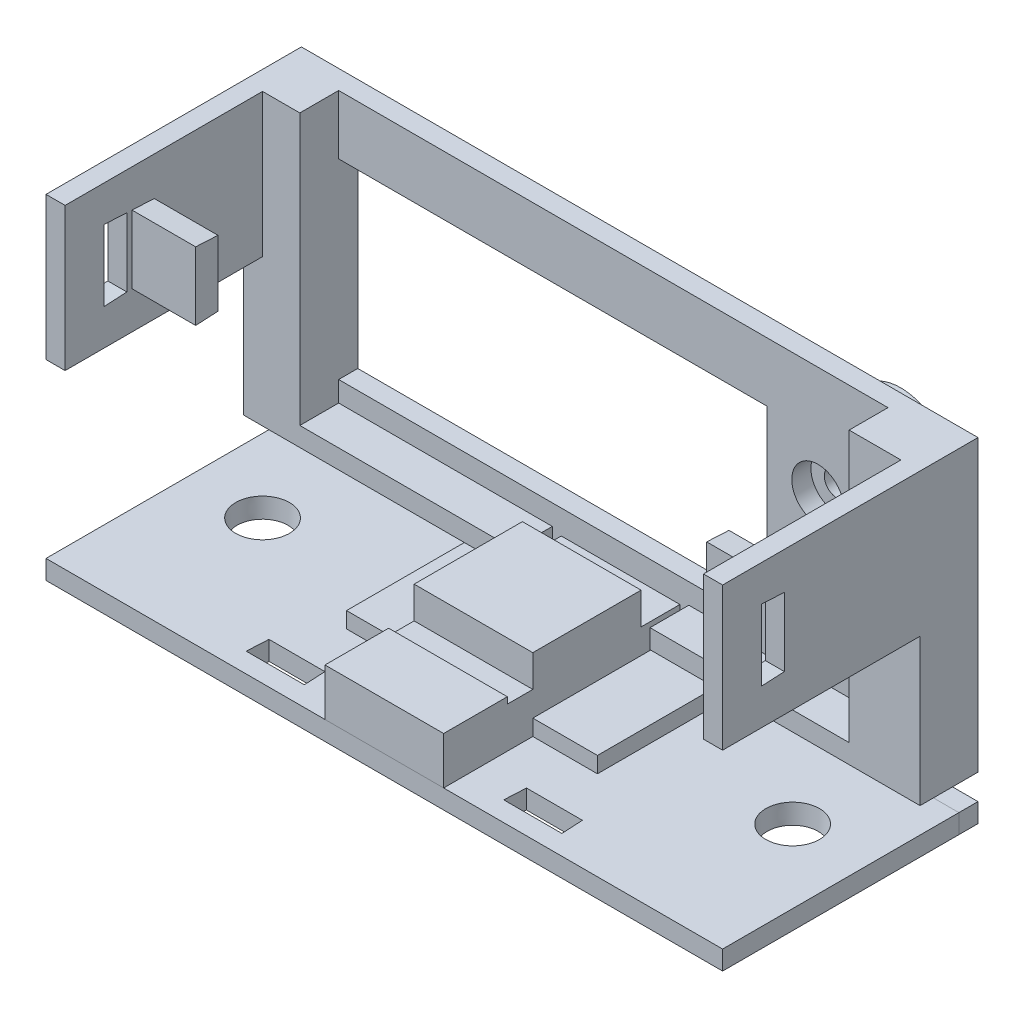
from build123d import *

# Parameters (mm, degrees)
SKETCH1_W                              = 53.116817528
SKETCH1_H                              = 26.25
FRONT_SIDE_MAIN_DEPTH                  = 1.5
RESET_HOLE_DEPTH                       = 3.75
SKETCH15_W                             = 3.966010581
SKETCH15_H                             = 2.112155191
SKETCH15_W_2                           = 3.557190409
SKETCH15_H_2                           = 2.236587576
SKETCH15_W_3                           = 3.981127105
SKETCH15_H_3                           = 2.476855865
COMPONENT_HOLES_DEPTH                  = 3.75
SKETCH16_W                             = 10.85
SKETCH16_H                             = 14.75
MICROPHONE_HOLE_DEPTH                  = 1.5
SKETCH24_W                             = 1.5
SKETCH24_H                             = 11.233042059
RIGHT_SIDE_TOP_DEPTH                   = 18.55
SNAP_GROOVE_RIGHT_DEPTH                = 1.5
SKETCH26_W                             = 1.5
SKETCH26_H                             = 11.233042059
LEFT_SIDE_TOP_DEPTH                    = 18.55
SNAP_START                             = 51.616817528
SNAP_GROOVE_LEFT_DEPTH                 = 1.5
SKETCH20_W                             = 53.116817528
SKETCH20_H                             = 1.5
BOTTOM_BASE_DEPTH                      = 18.55
SERVO_START                            = -1.5
SKETCH18_W                             = 9.316817528
SKETCH18_H                             = 3.2
SERVO_SEPERATOR_BOTTOM_DEPTH           = 20.05
SKETCH34_W                             = 2.537171882
SKETCH34_H                             = 15
PROGRAMMING_HOLE_DEPTH                 = 3.75
SKETCH38_W                             = 9.316817528
SKETCH38_H                             = 5
BACK_BATTERY_HOLDER_BOTTOM_DEPTH       = 0.504457941
SKETCH40_R                             = 2
SERVO_ARM_HOLES_BOTTOM_DEPTH           = 1.5
SERVO_ARM_HOLES_BOTTOM_DRAFT           = 4
SERVO_ARM_HOLES_BOTTOM_PROFILE_2_DEPTH = 1.5
SERVO_ARM_HOLES_BOTTOM_PROFILE_2_DRAFT = 4
SKETCH47_W                             = 11
SKETCH47_H                             = 2
SOLAR_ARM_HOLES_FRONT_DEPTH            = 1.5
SKETCH48_W                             = 9.316817528
SKETCH48_H                             = 8.5
SERVO_TALLER_SEPERATOR_BOTTOM_DEPTH    = 2.5
SKETCH51_W                             = 5.074553148
SKETCH51_H                             = 11.55
SKETCH51_W_2                           = 5.306259021
SERVO_LIFTERS_BOTTOM_DEPTH             = 1.25
SKETCH52_W                             = 21.2
SKETCH52_H                             = 1.5
SERVO_UNDER_SUPPORT_DEPTH              = 3.05
SKETCH49_W                             = 1.573389805
SKETCH49_H                             = 10.535992885
SERVO_2_CASE_SPACER_FRONT_DEPTH        = 3.05
SERVO_TOP_SUPPORT_RIGHT_DEPTH          = 5
SERVO_TOP_SUPPORT_LEFT_DEPTH           = 5
SNAP_GROOVE_BOTTOM_RIGHT_DEPTH         = 1.5
SNAP_GROOVE_BOTTOM_LEFT_DEPTH          = 1.5
SKETCH56_W                             = 32.587188542
SKETCH56_H                             = 15
CUT_EXTRUDE1_DEPTH                     = 1.5
SKETCH57_W                             = 8.5
SKETCH57_H                             = 1.5
BOSS_EXTRUDE1_DEPTH                    = 14.75
SKETCH58_R                             = 2.05
CUT_EXTRUDE2_DEPTH                     = 10
SKETCH59_W                             = 1.5
SKETCH59_H                             = 15
BOSS_EXTRUDE2_DEPTH                    = 1.5
SKETCH60_W                             = 2.925575138
SKETCH60_H                             = 19.525
BOSS_EXTRUDE3_DEPTH                    = 3.05
SKETCH62_W                             = 3.05
SKETCH62_H                             = 10.535992885
BOSS_EXTRUDE4_DEPTH                    = 3.993492161
SKETCH63_W                             = 4.066881966
SKETCH63_H                             = 3.05
BOSS_EXTRUDE5_DEPTH                    = 8.989007115
SKETCH64_W                             = 3.05
SKETCH64_H                             = 8.291957941
BOSS_EXTRUDE6_DEPTH                    = 1.5
BOSS_EXTRUDE7_REACH                    = 62.039
SKETCH65_W                             = 4.425575138
SKETCH65_H                             = 3.05
BOSS_EXTRUDE8_REACH                    = 62.039
SKETCH66_W                             = 5.566881966
SKETCH66_H                             = 3.05
SKETCH67_R                             = 4
SKETCH67_R_2                           = 1
BOSS_EXTRUDE9_DEPTH                    = 5


# Read off the part's stored shape, not the designer's step: Snap Groove - Right, Snap Groove - Left, Snap Groove - Bottom Right, Snap Groove - Bottom Left
with BuildPart() as part:
    # Sketch1 → Front Side - Main (new body)
    with BuildSketch(Plane.XY):
        with Locations((26.558408764, 13.125)):
            Rectangle(SKETCH1_W, SKETCH1_H)
    extrude(amount=FRONT_SIDE_MAIN_DEPTH)

    # Reset Hole Sketch → Reset Hole (cut)
    with BuildSketch(Plane(origin=(0, 0, 3.75), x_dir=(-1, 0, 0), z_dir=(0, 0, -1))):
        Polygon((-31.190735744, 17.626168756), (-34.141748042, 17.658585925), (-36.251351249, 15.594827519), (-36.283768419, 12.643815222), (-34.220010013, 10.534212015), (-31.268997715, 10.501794845), (-29.159394508, 12.565553251), (-29.126977338, 15.516565548), align=None)
    extrude(amount=RESET_HOLE_DEPTH, mode=Mode.SUBTRACT)

    # Sketch15 → Component Holes (cut)
    with BuildSketch(Plane(origin=(0, 0, 3.75), x_dir=(-1, 0, 0), z_dir=(0, 0, -1))):
        Polygon((-21.737702993, 20.027277789), (-15.857179586, 14.146754382), (-21.737702993, 8.266230975), (-27.6182264, 14.146754382), align=None)
        with Locations((-11.649935563, 9.695513201)):
            Rectangle(SKETCH15_W, SKETCH15_H)
        with Locations((-11.599935563, 14.270513201)):
            Rectangle(SKETCH15_W_2, SKETCH15_H_2)
        with Locations((-9.949935563, 18.095513201)):
            Rectangle(SKETCH15_W_3, SKETCH15_H_3)
    extrude(amount=COMPONENT_HOLES_DEPTH, mode=Mode.SUBTRACT)

    # Sketch16 → Microphone Hole (cut)
    with BuildSketch(Plane(origin=(0, 0, 0), x_dir=(-1, 0, 0), z_dir=(0, 0, -1))):
        with Locations((-41.124935562, 14.1)):
            Rectangle(SKETCH16_W, SKETCH16_H)
    extrude(amount=-MICROPHONE_HOLE_DEPTH, mode=Mode.SUBTRACT)

    # Sketch24 → Right Side - Top (add)
    with BuildSketch(Plane.XY.offset(1.5)):
        with Locations((0.75, 20.633478971)):
            Rectangle(SKETCH24_W, SKETCH24_H)
    extrude(amount=RIGHT_SIDE_TOP_DEPTH)

    # Snap Groove - Right outline → Snap Groove - Right (cut)
    with BuildSketch(Plane.YZ):
        Polygon((17.938719748, 15.2), (23.328238192, 15.2), (23.422572195, 17), (17.844385746, 17), align=None)
    extrude(amount=SNAP_GROOVE_RIGHT_DEPTH, mode=Mode.SUBTRACT)

    # Sketch26 → Left Side - Top (add)
    with BuildSketch(Plane.XY.offset(1.5)):
        with Locations((52.366817528, 20.633478971)):
            Rectangle(SKETCH26_W, SKETCH26_H)
    extrude(amount=LEFT_SIDE_TOP_DEPTH)

    # Snap Groove - Left outline → Snap Groove - Left (cut)
    with BuildSketch(Plane.YZ.offset(SNAP_START)):
        Polygon((17.938719748, 15.2), (23.328238192, 15.2), (23.422572195, 17), (17.844385746, 17), align=None)
    extrude(amount=SNAP_GROOVE_LEFT_DEPTH, mode=Mode.SUBTRACT)

    # Sketch18 → Servo Seperator - Bottom (add)
    with BuildSketch(Plane.XY.offset(1.5).offset(SERVO_START)):
        with Locations((26.558408764, 3.1)):
            Rectangle(SKETCH18_W, SKETCH18_H)
    extrude(amount=SERVO_SEPERATOR_BOTTOM_DEPTH)

    # Sketch34 → Programming Hole (cut)
    with BuildSketch(Plane(origin=(0, 0, 0), x_dir=(-1, 0, 0), z_dir=(0, 0, -1))):
        with Locations((-4.194161079, 14.100049249)):
            Rectangle(SKETCH34_W, SKETCH34_H)
    extrude(amount=-PROGRAMMING_HOLE_DEPTH, mode=Mode.SUBTRACT)

    # Sketch38 → Back Battery Holder - Bottom (add)
    with BuildSketch(Plane(origin=(0, 4.7, 0), x_dir=(1, 0, 0), z_dir=(0, 1, 0))):
        with Locations((26.558408764, -17.55)):
            Rectangle(SKETCH38_W, SKETCH38_H)
    extrude(amount=BACK_BATTERY_HOLDER_BOTTOM_DEPTH)

    # Sketch47 → Solar Arm Holes - Front (cut)
    with BuildSketch(Plane(origin=(0, 0, 0), x_dir=(-1, 0, 0), z_dir=(0, 0, -1))):
        with Locations((-47.616817528, 2.5)):
            Rectangle(SKETCH47_W, SKETCH47_H)
        with Locations((-5.5, 2.5)):
            Rectangle(SKETCH47_W, SKETCH47_H)
    extrude(amount=-SOLAR_ARM_HOLES_FRONT_DEPTH, mode=Mode.SUBTRACT)

    # Sketch48 → Servo Taller Seperator - Bottom (add)
    with BuildSketch(Plane(origin=(0, 4.7, 0), x_dir=(1, 0, 0), z_dir=(0, 1, 0))):
        with Locations((26.558408764, -8.8)):
            Rectangle(SKETCH48_W, SKETCH48_H)
    extrude(amount=SERVO_TALLER_SEPERATOR_BOTTOM_DEPTH)

    # Sketch51 → Servo Lifters - Bottom (add)
    with BuildSketch(Plane(origin=(0, 1.5, 0), x_dir=(1, 0, 0), z_dir=(0, 1, 0))):
        with Locations((33.754094102, -7.275)):
            Rectangle(SKETCH51_W, SKETCH51_H)
        with Locations((19.24687049, -7.275)):
            Rectangle(SKETCH51_W_2, SKETCH51_H)
    extrude(amount=SERVO_LIFTERS_BOTTOM_DEPTH)

    # Sketch52 → Servo Under Support (add)
    with BuildSketch(Plane.XY.offset(1.5)):
        with Locations((10.6, 4.25)):
            Rectangle(SKETCH52_W, SKETCH52_H)
        with Locations((42.516817528, 4.25)):
            Rectangle(SKETCH52_W, SKETCH52_H)
    extrude(amount=SERVO_UNDER_SUPPORT_DEPTH)

    # Sketch49 → Servo 2 Case Spacer - Front (add)
    with BuildSketch(Plane.XY.offset(1.5)):
        with Locations((48.336630465, 11.992996443)):
            Rectangle(SKETCH49_W, SKETCH49_H)
    extrude(amount=SERVO_2_CASE_SPACER_FRONT_DEPTH)

    # Sketch53 → Servo Top Support - Right (add)
    with BuildSketch(Plane(origin=(1.5, 0, 0), x_dir=(0, 0, -1), z_dir=(1, 0, 0))):
        Polygon((-14.8, 23.307275081), (-13.05, 23.215561467), (-13.05, 18.051396474), (-14.8, 17.95968286), align=None)
    extrude(amount=SERVO_TOP_SUPPORT_RIGHT_DEPTH)

    # Sketch55 → Servo Top Support - Left (add)
    with BuildSketch(Plane.ZY.offset(-51.616817528)):
        Polygon((14.8, 17.95968286), (14.8, 23.307275081), (13.05, 23.215561467), (13.05, 18.051396474), align=None)
    extrude(amount=SERVO_TOP_SUPPORT_LEFT_DEPTH)

    # Sketch56 → Cut-Extrude1 (cut)
    with BuildSketch(Plane(origin=(0, 0, 0), x_dir=(-1, 0, 0), z_dir=(0, 0, -1))):
        with Locations((-21.756341291, 14.100049249)):
            Rectangle(SKETCH56_W, SKETCH56_H)
    extrude(amount=-CUT_EXTRUDE1_DEPTH, mode=Mode.SUBTRACT)

    # Sketch57 → Boss-Extrude1 (add)
    with BuildSketch(Plane.XZ.offset(-21.475)):
        with Locations((42.299935562, 0.75)):
            Rectangle(SKETCH57_W, SKETCH57_H)
    extrude(amount=BOSS_EXTRUDE1_DEPTH)

    # Sketch58 → Cut-Extrude2 (cut)
    with BuildSketch(Plane(origin=(0, 0, 0), x_dir=(-1, 0, 0), z_dir=(0, 0, -1))):
        with Locations((-42.049935562, 17.600049249)):
            Circle(SKETCH58_R)
    extrude(amount=-CUT_EXTRUDE2_DEPTH, mode=Mode.SUBTRACT)

    # Sketch59 → Boss-Extrude2 (add)
    with BuildSketch(Plane(origin=(2.925575138, 0, 0), x_dir=(0, 0, -1), z_dir=(1, 0, 0))):
        with Locations((-0.75, 14.100049249)):
            Rectangle(SKETCH59_W, SKETCH59_H)
    extrude(amount=BOSS_EXTRUDE2_DEPTH)

    # Sketch60 → Boss-Extrude3 (add)
    with BuildSketch(Plane.XY.offset(1.5)):
        with Locations((2.962787569, 16.4875)):
            Rectangle(SKETCH60_W, SKETCH60_H)
    extrude(amount=BOSS_EXTRUDE3_DEPTH)

    # Sketch62 → Boss-Extrude4 (add)
    with BuildSketch(Plane(origin=(49.123325367, 0, 0), x_dir=(0, 0, -1), z_dir=(1, 0, 0))):
        with Locations((-3.025, 11.992996443)):
            Rectangle(SKETCH62_W, SKETCH62_H)
    extrude(amount=BOSS_EXTRUDE4_DEPTH)

    # Sketch63 → Boss-Extrude5 (add)
    with BuildSketch(Plane(origin=(0, 17.260992885, 0), x_dir=(1, 0, 0), z_dir=(0, 1, 0))):
        with Locations((49.583376545, -3.025)):
            Rectangle(SKETCH63_W, SKETCH63_H)
    extrude(amount=BOSS_EXTRUDE5_DEPTH)

    # Sketch64 → Boss-Extrude6 (add)
    with BuildSketch(Plane.ZY.offset(-1.5)):
        with Locations((3.025, 10.870978971)):
            Rectangle(SKETCH64_W, SKETCH64_H)
    extrude(amount=BOSS_EXTRUDE6_DEPTH)

    # Sketch65 → Boss-Extrude7 (add, up to next)
    with BuildSketch(Plane.XZ.offset(-6.725), mode=Mode.PRIVATE) as boss_extrude7_sk1:
        with Locations((2.212787569, 3.025)):
            Rectangle(SKETCH65_W, SKETCH65_H)
    boss_extrude7_tool1 = extrude(boss_extrude7_sk1.sketch, amount=BOSS_EXTRUDE7_REACH, mode=Mode.PRIVATE) - part.part
    add(boss_extrude7_tool1.solids().sort_by_distance((2.212788, 6.725, 3.025))[0])

    # Sketch66 → Boss-Extrude8 (add, up to next)
    with BuildSketch(Plane.XZ.offset(-6.725), mode=Mode.PRIVATE) as boss_extrude8_sk1:
        with Locations((50.333376545, 3.025)):
            Rectangle(SKETCH66_W, SKETCH66_H)
    boss_extrude8_tool1 = extrude(boss_extrude8_sk1.sketch, amount=BOSS_EXTRUDE8_REACH, mode=Mode.PRIVATE) - part.part
    add(boss_extrude8_tool1.solids().sort_by_distance((50.333377, 6.725, 3.025))[0])

    # Sketch67 → Boss-Extrude9 (add)
    with BuildSketch(Plane(origin=(0, 0, 0), x_dir=(-1, 0, 0), z_dir=(0, 0, -1))):
        with Locations((-42.049935562, 17.600049249)):
            Circle(SKETCH67_R)
        with Locations((-42.049935562, 17.600049249)):
            Circle(SKETCH67_R_2, mode=Mode.SUBTRACT)
    extrude(amount=BOSS_EXTRUDE9_DEPTH)


with BuildPart() as body_2:
    # Sketch20 → Bottom Base (new body)
    with BuildSketch(Plane.XY.offset(1.5)):
        with Locations((26.558408764, 0.75)):
            Rectangle(SKETCH20_W, SKETCH20_H)
    extrude(amount=BOTTOM_BASE_DEPTH)


with BuildPart() as servo_arm_holes_bottom_tool:
    # Sketch40 → Servo arm Holes - Bottom (with draft: the straight prism first)
    with BuildSketch(Plane.XZ):
        with Locations((47.366817528, 8.8)):
            Circle(SKETCH40_R)
    extrude(amount=-SERVO_ARM_HOLES_BOTTOM_DEPTH)
    # Servo arm Holes - Bottom: the draft: its side faces are tilted about the plane it starts from
    servo_arm_holes_bottom_sides = [servo_arm_holes_bottom_tool.faces().sort_by_distance(p)[0] for p in [
        (45.366817528, 0.75, 8.8),
    ]]
    draft(servo_arm_holes_bottom_sides, Plane.XZ, SERVO_ARM_HOLES_BOTTOM_DRAFT)


with BuildPart() as body_2_1:
    add(body_2.part)

    # Servo arm Holes - Bottom: cut by servo_arm_holes_bottom_tool
    add(servo_arm_holes_bottom_tool.part, mode=Mode.SUBTRACT)


with BuildPart() as servo_arm_holes_bottom_profile_2_tool:
    # Sketch40 → Servo arm Holes - Bottom profile 2 (with draft: the straight prism first)
    with BuildSketch(Plane.XZ):
        with Locations((5.75, 8.8)):
            Circle(SKETCH40_R)
    extrude(amount=-SERVO_ARM_HOLES_BOTTOM_PROFILE_2_DEPTH)
    # Servo arm Holes - Bottom profile 2: the draft: its side faces are tilted about the plane it starts from
    servo_arm_holes_bottom_profile_2_sides = [servo_arm_holes_bottom_profile_2_tool.faces().sort_by_distance(p)[0] for p in [
        (3.75, 0.75, 8.8),
    ]]
    draft(servo_arm_holes_bottom_profile_2_sides, Plane.XZ, SERVO_ARM_HOLES_BOTTOM_PROFILE_2_DRAFT)


with BuildPart() as body_2_2:
    add(body_2_1.part)

    # Servo arm Holes - Bottom profile 2: cut by servo_arm_holes_bottom_profile_2_tool
    add(servo_arm_holes_bottom_profile_2_tool.part, mode=Mode.SUBTRACT)

    # Snap Groove - Bottom Right outline → Snap Groove - Bottom Right (cut)
    with BuildSketch(Plane(origin=(0, 0, 0), x_dir=(1, 0, 0), z_dir=(0, 1, 0))):
        Polygon((14.166147553, -18.5), (18.733852447, -18.5), (18.644759222, -16.8), (14.255240778, -16.8), align=None)
    extrude(amount=SNAP_GROOVE_BOTTOM_RIGHT_DEPTH, mode=Mode.SUBTRACT)

    # Snap Groove - Bottom Left outline → Snap Groove - Bottom Left (cut)
    with BuildSketch(Plane(origin=(0, 0, 0), x_dir=(1, 0, 0), z_dir=(0, 1, 0))):
        Polygon((38.950669975, -18.5), (38.86157675, -16.8), (34.472058306, -16.8), (34.382965081, -18.5), align=None)
    extrude(amount=SNAP_GROOVE_BOTTOM_LEFT_DEPTH, mode=Mode.SUBTRACT)


solid = Compound([part.part, body_2_2.part])
